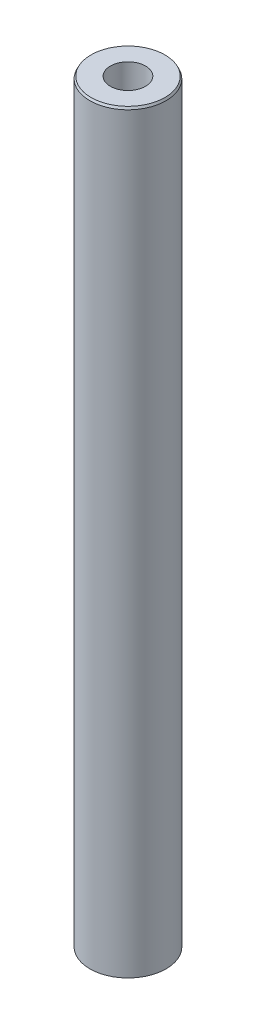
from build123d import *
from OCP.BRepFilletAPI import BRepFilletAPI_MakeChamfer

# Parameters (mm, degrees)
SKETCH1_R           = 5
BOSS_EXTRUDE1_DEPTH = 99.12697805
SKETCH2_R           = 2.310056849
CUT_EXTRUDE1_DEPTH  = 100.37885981
CHAMFER1_SIZE       = 0.291338269
CHAMFER1_SIZE2      = 0.150529227


with BuildPart() as part:
    # Sketch1 → Boss-Extrude1 (new body)
    with BuildSketch(Plane(origin=(0, 0, 0), x_dir=(1, 0, 0), z_dir=(0, 1, 0))):
        Circle(SKETCH1_R)
    extrude(amount=BOSS_EXTRUDE1_DEPTH)

    # Sketch2 → Cut-Extrude1 (cut, through all)
    with BuildSketch(Plane(origin=(0, 0, 0), x_dir=(1, 0, 0), z_dir=(0, 1, 0))):
        Circle(SKETCH2_R)
    extrude(amount=CUT_EXTRUDE1_DEPTH, mode=Mode.SUBTRACT)

    # Chamfer1: one chamfer whose edges measure the first distance from different faces: ONE call of the kernel's chamfer builder (chamfer() names one face for all edges)
    chamfer1_edges_1 = [part.edges().sort_by_distance(p)[0] for p in [
        (-5, 99.12697805, 0),
    ]]
    chamfer1_side_1 = [part.faces().sort_by_distance(p)[0] for p in [
        (-5, 49.563489025, 0),
    ]]
    chamfer1_edges_2 = [part.edges().sort_by_distance(p)[0] for p in [
        (-5, 0, 0),
    ]]
    chamfer1_side_2 = [part.faces().sort_by_distance(p)[0] for p in [
        (-4.858578644, 0, 0),
    ]]
    chamfer1 = BRepFilletAPI_MakeChamfer(part.part.solid().wrapped)
    for e in chamfer1_edges_1:
        chamfer1.Add(CHAMFER1_SIZE, CHAMFER1_SIZE2, e.wrapped, chamfer1_side_1[0].wrapped)  # the first distance lies on this face
    for e in chamfer1_edges_2:
        chamfer1.Add(CHAMFER1_SIZE, CHAMFER1_SIZE2, e.wrapped, chamfer1_side_2[0].wrapped)  # the first distance lies on this face
    add(Compound.cast(chamfer1.Shape()), mode=Mode.REPLACE)


solid = part.part
